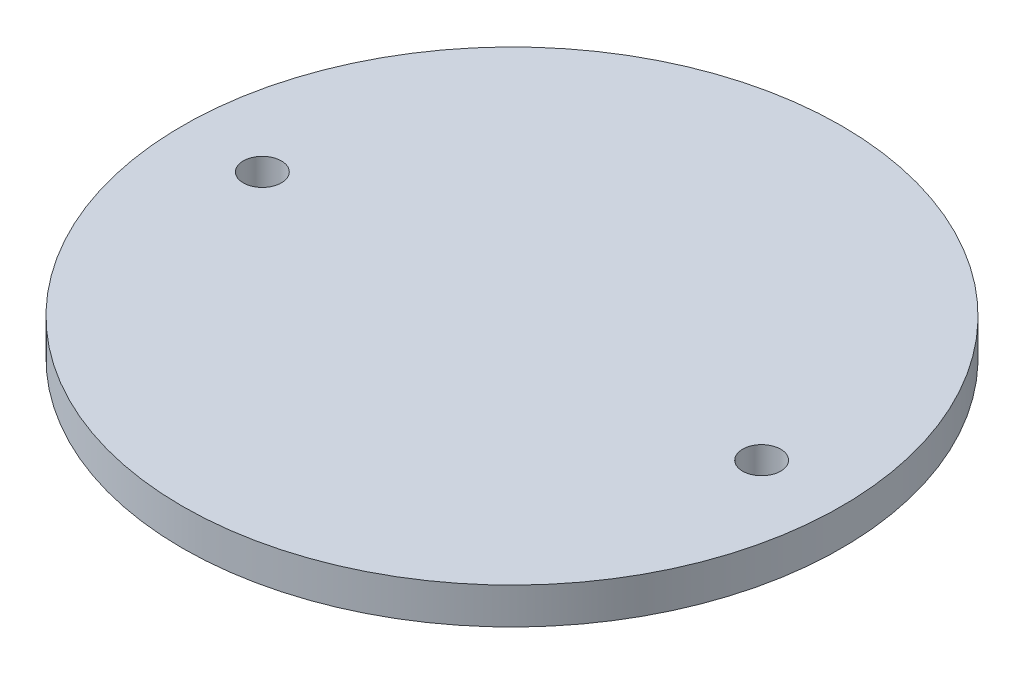
from build123d import *

# Parameters (mm, degrees)
SKETCH1_R           = 36.3
SKETCH1_R_2         = 2.1
BOSS_EXTRUDE1_DEPTH = 4


with BuildPart() as part:
    # Sketch1 → Boss-Extrude1 (new body)
    with BuildSketch(Plane(origin=(0, 0, 0), x_dir=(1, 0, 0), z_dir=(0, 1, 0))):
        Circle(SKETCH1_R)
        with Locations((-27.5, 0)):
            Circle(SKETCH1_R_2, mode=Mode.SUBTRACT)
        with Locations((27.5, 0)):
            Circle(SKETCH1_R_2, mode=Mode.SUBTRACT)
    extrude(amount=BOSS_EXTRUDE1_DEPTH)


solid = part.part
